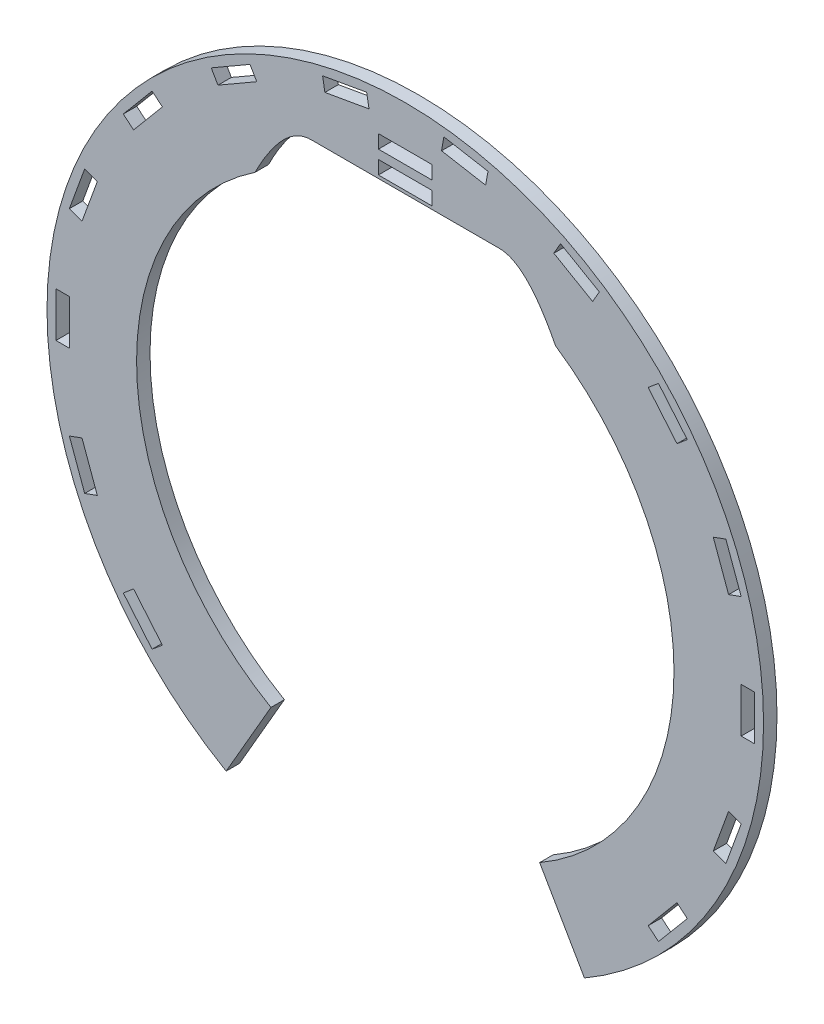
from build123d import *

# Parameters (mm, degrees)
P_IDAT_VYSUNUT_M1_DEPTH  = 3
SKICA3_W                 = 12
SKICA3_H                 = 3
SKICA3_W_2               = 3
SKICA3_H_2               = 10
ODEBRAT_VYSUNUT_M1_DEPTH = 3
ODEBRAT_VYSUNUT_M3_DEPTH = 3


with BuildPart() as part:
    # Skica1 → Přidat vysunutím1 (new body)
    with BuildSketch(Plane.XY):
        with BuildLine():
            Line((-40, -69.282032303), (-30, -51.961524227))
            ThreePointArc((-30, -51.961524227), (0, 60), (30, -51.961524227))
            Line((30, -51.961524227), (40, -69.282032303))
            ThreePointArc((40, -69.282032303), (0, 80), (-40, -69.282032303))
        make_face()
    extrude(amount=P_IDAT_VYSUNUT_M1_DEPTH)

    # Skica3 → Odebrat vysunutím1 (cut)
    with BuildSketch(Plane.XY.offset(3)):
        Polygon((-43.330127019, 65.049981495), (-34.669872981, 70.049981495), (-33.169872981, 67.451905284), (-41.830127019, 62.451905284), align=None)
        with Locations((0, 64.5)):
            Rectangle(SKICA3_W, SKICA3_H)
        Polygon((-18.468596623, 75.946763847), (-8.620519093, 77.683245623), (-8.09957456, 74.728822364), (-17.94765209, 72.992340588), align=None)
        Polygon((8.620519093, 77.683245623), (18.468596623, 75.946763847), (17.94765209, 72.992340588), (8.09957456, 74.728822364), align=None)
        Polygon((34.669872981, 70.049981495), (43.330127019, 65.049981495), (41.830127019, 62.451905284), (33.169872981, 67.451905284), align=None)
        Polygon((56.537528515, 53.967655771), (62.965404612, 46.30721134), (60.667271282, 44.378848511), (54.239395185, 52.039292942), align=None)
        Polygon((71.585923705, 31.376034283), (75.006125138, 21.979108075), (72.187047276, 20.953047646), (68.766845842, 30.349973853), align=None)
        with Locations((76.5, 0)):
            Rectangle(SKICA3_W_2, SKICA3_H_2)
        Polygon((75.006125138, -21.979108075), (71.585923705, -31.376034283), (68.766845842, -30.349973853), (72.187047276, -20.953047645), align=None)
        Polygon((62.965404612, -46.30721134), (56.537528515, -53.967655771), (54.239395186, -52.039292942), (60.667271282, -44.378848511), align=None)
        Polygon((-56.537528515, -53.967655771), (-62.965404612, -46.30721134), (-60.667271282, -44.378848511), (-54.239395185, -52.039292942), align=None)
        Polygon((-71.585923705, -31.376034283), (-75.006125138, -21.979108075), (-72.187047276, -20.953047645), (-68.766845842, -30.349973853), align=None)
        with Locations((-76.5, 0)):
            Rectangle(SKICA3_W_2, SKICA3_H_2)
        Polygon((-75.006125138, 21.979108075), (-71.585923705, 31.376034283), (-68.766845842, 30.349973853), (-72.187047276, 20.953047645), align=None)
        Polygon((-62.965404612, 46.30721134), (-56.537528515, 53.967655771), (-54.239395185, 52.039292942), (-60.667271282, 44.378848511), align=None)
        with Locations((0, 69.5)):
            Rectangle(SKICA3_W, SKICA3_H)
    extrude(amount=-ODEBRAT_VYSUNUT_M1_DEPTH, mode=Mode.SUBTRACT)

    # Skica4 → Odebrat vysunutím3 (cut)
    with BuildSketch(Plane(origin=(0, 0, 0), x_dir=(-1, 0, 0), z_dir=(0, 0, -1))):
        with BuildLine():
            Line((-21, 62.31), (21, 62.31))
            add(Edge.make_bspline(
                [(21, 62.31), (27.196611035, 62.31), (33.53452321, 49.753751146)],
                knots=[0, 0, 0, 1, 1, 1], degree=2))
            Line((33.53452321, 49.753751146), (-33.53452321, 49.753751146))
            add(Edge.make_bspline(
                [(-21, 62.31), (-27.196611035, 62.31), (-33.53452321, 49.753751146)],
                knots=[0, 0, 0, 1, 1, 1], degree=2))
        make_face()
    extrude(amount=-ODEBRAT_VYSUNUT_M3_DEPTH, mode=Mode.SUBTRACT)


solid = part.part
